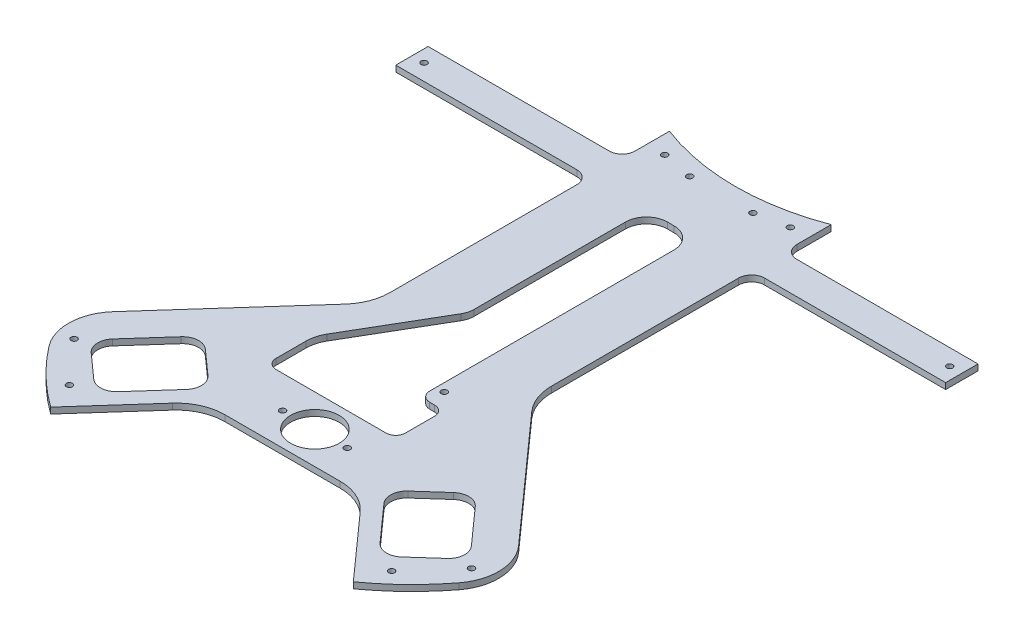
from build123d import *

# Parameters (mm, degrees)
SKETCH1_R           = 2.38125
BOSS_EXTRUDE1_DEPTH = 4.7625
SKETCH2_R           = 2.38125
CUT_EXTRUDE1_DEPTH  = 343.797654481
FILLET1_R           = 38.1
SKETCH4_R           = 2.38125
CUT_EXTRUDE3_DEPTH  = 343.797654481
FILLET2_R           = 38.1
CUT_EXTRUDE4_DEPTH  = 338.871506933
FILLET3_R           = 12.7
SKETCH6_R           = 19.05
CUT_EXTRUDE5_DEPTH  = 338.871506933
SKETCH7_W           = 38.1
SKETCH7_H           = 254
CUT_EXTRUDE6_DEPTH  = 338.871506933
SKETCH8_W           = 101.6
SKETCH8_H           = 38.1
CUT_EXTRUDE7_DEPTH  = 338.871506933
CUT_EXTRUDE8_DEPTH  = 338.871506933
FILLET4_R           = 25.4
FILLET5_R           = 7.62
FILLET8_R           = 16.51
SKETCH10_R          = 177.8
SKETCH10_R_2        = 2.38125
CUT_EXTRUDE9_DEPTH  = 338.871506933
SKETCH11_W          = 431.8
SKETCH11_H          = 25.4
BOSS_EXTRUDE2_DEPTH = 4.7625
FILLET9_R           = 10.16
SKETCH12_R          = 2.38125
CUT_EXTRUDE10_DEPTH = 343.411699629


with BuildPart() as part:
    # Sketch1 → Boss-Extrude1 (new body)
    with BuildSketch(Plane(origin=(0, 0, 0), x_dir=(1, 0, 0), z_dir=(0, 1, 0))):
        with BuildLine():
            Line((63.5, 31.75), (63.5, 292.608))
            Line((63.5, 292.608), (-63.5, 292.608))
            Line((-63.5, 292.608), (-63.5, 31.75))
            Line((-63.5, 31.75), (-178.516410583, -97.067662754))
            ThreePointArc((-178.516410583, -97.067662754), (-152.483723292, -134.309173667), (-118.826410583, -164.834838999))
            Line((-118.826410583, -164.834838999), (-62.366418607, -101.6))
            Line((-62.366418607, -101.6), (62.366418607, -101.6))
            Line((62.366418607, -101.6), (118.826410583, -164.834838999))
            ThreePointArc((118.826410583, -164.834838999), (152.483723292, -134.309173667), (178.516410583, -97.067662754))
            Line((178.516410583, -97.067662754), (63.5, 31.75))
        make_face()
        with Locations((-25.4, 0)):
            Circle(SKETCH1_R, mode=Mode.SUBTRACT)
        with Locations((25.4, 0)):
            Circle(SKETCH1_R, mode=Mode.SUBTRACT)
        with Locations((25.4, -76.2)):
            Circle(SKETCH1_R, mode=Mode.SUBTRACT)
        with Locations((-25.4, -76.2)):
            Circle(SKETCH1_R, mode=Mode.SUBTRACT)
    extrude(amount=BOSS_EXTRUDE1_DEPTH)

    # Sketch2 → Cut-Extrude1 (cut, through all)
    with BuildSketch(Plane(origin=(0, 4.7625, 0), x_dir=(1, 0, 0), z_dir=(0, 1, 0))):
        with Locations((25.4, 279.908)):
            Circle(SKETCH2_R)
        with Locations((50.8, 279.908)):
            Circle(SKETCH2_R)
        with Locations((-50.8, 279.908)):
            Circle(SKETCH2_R)
        with Locations((-25.4, 279.908)):
            Circle(SKETCH2_R)
    extrude(amount=-CUT_EXTRUDE1_DEPTH, mode=Mode.SUBTRACT)

    # Fillet1
    fillet1_edges = [part.edges().sort_by_distance(p)[0] for p in [
        (63.5, 2.38125, -31.75),
        (-63.5, 2.38125, -31.75),
        (62.366418607, 2.38125, 101.6),
        (-62.366418607, 2.38125, 101.6),
    ]]
    fillet(fillet1_edges, radius=FILLET1_R)

    # Sketch4 → Cut-Extrude3 (cut, through all)
    with BuildSketch(Plane(origin=(0, 4.7625, 0), x_dir=(1, 0, 0), z_dir=(0, 1, 0))):
        with Locations((-156.048464437, -109.266311125)):
            Circle(SKETCH4_R)
        with Locations((-126.479111192, -142.454499515)):
            Circle(SKETCH4_R)
        with Locations((126.479111192, -142.454499515)):
            Circle(SKETCH4_R)
        with Locations((156.048464437, -109.266311125)):
            Circle(SKETCH4_R)
    extrude(amount=-CUT_EXTRUDE3_DEPTH, mode=Mode.SUBTRACT)

    # Fillet2
    fillet2_edges = [part.edges().sort_by_distance(p)[0] for p in [
        (178.516410583, 2.38125, 97.067662754),
        (-178.516410583, 2.38125, 97.067662754),
    ]]
    fillet(fillet2_edges, radius=FILLET2_R)

    # Sketch5 → Cut-Extrude4 (cut, through all)
    with BuildSketch(Plane(origin=(0, 4.7625, 0), x_dir=(1, 0, 0), z_dir=(0, 1, 0))):
        Polygon((-149.276482194, -103.59593683), (-111.382942554, -137.429642709), (-69.090810204, -90.062718159), (-106.984349844, -56.22901228), align=None)
        Polygon((106.984349844, -56.22901228), (69.090810204, -90.062718159), (111.382942554, -137.429642709), (149.276482194, -103.59593683), align=None)
    extrude(amount=-CUT_EXTRUDE4_DEPTH, mode=Mode.SUBTRACT)

    # Fillet3
    fillet3_edges = [part.edges().sort_by_distance(p)[0] for p in [
        (111.382942554, 2.38125, 137.429642709),
        (69.090810204, 2.38125, 90.062718159),
        (106.984349844, 2.38125, 56.22901228),
        (149.276482194, 2.38125, 103.59593683),
        (-69.090810204, 2.38125, 90.062718159),
        (-106.984349844, 2.38125, 56.22901228),
        (-149.276482194, 2.38125, 103.59593683),
        (-111.382942554, 2.38125, 137.429642709),
    ]]
    fillet(fillet3_edges, radius=FILLET3_R)

    # Sketch6 → Cut-Extrude5 (cut, through all)
    with BuildSketch(Plane(origin=(0, 4.7625, 0), x_dir=(1, 0, 0), z_dir=(0, 1, 0))):
        with Locations((0, -76.2)):
            Circle(SKETCH6_R)
    extrude(amount=-CUT_EXTRUDE5_DEPTH, mode=Mode.SUBTRACT)

    # Sketch7 → Cut-Extrude6 (cut, through all)
    with BuildSketch(Plane(origin=(0, 4.7625, 0), x_dir=(1, 0, 0), z_dir=(0, 1, 0))):
        with Locations((0, 76.2)):
            Rectangle(SKETCH7_W, SKETCH7_H)
    extrude(amount=-CUT_EXTRUDE6_DEPTH, mode=Mode.SUBTRACT)

    # Sketch8 → Cut-Extrude7 (cut, through all)
    with BuildSketch(Plane(origin=(0, 4.7625, 0), x_dir=(1, 0, 0), z_dir=(0, 1, 0))):
        with Locations((-12.7, -31.75)):
            Rectangle(SKETCH8_W, SKETCH8_H)
    extrude(amount=-CUT_EXTRUDE7_DEPTH, mode=Mode.SUBTRACT)

    # Sketch9 → Cut-Extrude8 (cut, through all)
    with BuildSketch(Plane(origin=(0, 4.7625, 0), x_dir=(1, 0, 0), z_dir=(0, 1, 0))):
        Polygon((-63.5, -12.7), (-19.05, 63.5), (-19.05, -12.7), align=None)
    extrude(amount=-CUT_EXTRUDE8_DEPTH, mode=Mode.SUBTRACT)

    # Fillet4
    fillet4_edges = [part.edges().sort_by_distance(p)[0] for p in [
        (-63.5, 2.38125, 12.7),
    ]]
    fillet(fillet4_edges, radius=FILLET4_R)

    # Fillet5
    fillet5_edges = [part.edges().sort_by_distance(p)[0] for p in [
        (-63.5, 2.38125, 50.8),
        (38.1, 2.38125, 50.8),
        (38.1, 2.38125, 12.7),
        (19.05, 2.38125, 12.7),
    ]]
    fillet(fillet5_edges, radius=FILLET5_R)

    # Fillet8
    fillet8_edges = [part.edges().sort_by_distance(p)[0] for p in [
        (-19.05, 2.38125, -203.2),
        (19.05, 2.38125, -203.2),
        (-19.05, 2.38125, -63.5),
    ]]
    fillet(fillet8_edges, radius=FILLET8_R)

    # Sketch10 → Cut-Extrude9 (cut, through all)
    with BuildSketch(Plane(origin=(0, 4.7625, 0), x_dir=(1, 0, 0), z_dir=(0, 1, 0))):
        with Locations((0, 431.8)):
            Circle(SKETCH10_R)
        with Locations((-49.305028092, 247.791130092)):
            Circle(SKETCH10_R_2)
        with Locations((-24.865239618, 242.929753908)):
            Circle(SKETCH10_R_2)
        with Locations((24.865239618, 242.929753908)):
            Circle(SKETCH10_R_2)
        with Locations((49.305028092, 247.791130092)):
            Circle(SKETCH10_R_2)
    extrude(amount=-CUT_EXTRUDE9_DEPTH, mode=Mode.SUBTRACT)

    # Sketch11 → Boss-Extrude2 (add)
    with BuildSketch(Plane(origin=(0, 4.7625, 0), x_dir=(1, 0, 0), z_dir=(0, 1, 0))):
        with Locations((0, 215.9)):
            Rectangle(SKETCH11_W, SKETCH11_H)
    extrude(amount=-BOSS_EXTRUDE2_DEPTH)

    # Fillet9
    fillet9_edges = [part.edges().sort_by_distance(p)[0] for p in [
        (63.5, 2.38125, -203.2),
        (63.5, 2.38125, -228.6),
        (-63.5, 2.38125, -203.2),
        (-63.5, 2.38125, -228.6),
    ]]
    fillet(fillet9_edges, radius=FILLET9_R)

    # Sketch12 → Cut-Extrude10 (cut, through all)
    with BuildSketch(Plane(origin=(0, 4.7625, 0), x_dir=(1, 0, 0), z_dir=(0, 1, 0))):
        with Locations((-206.375, 215.9)):
            Circle(SKETCH12_R)
        with Locations((206.375, 215.9)):
            Circle(SKETCH12_R)
    extrude(amount=-CUT_EXTRUDE10_DEPTH, mode=Mode.SUBTRACT)


solid = part.part
